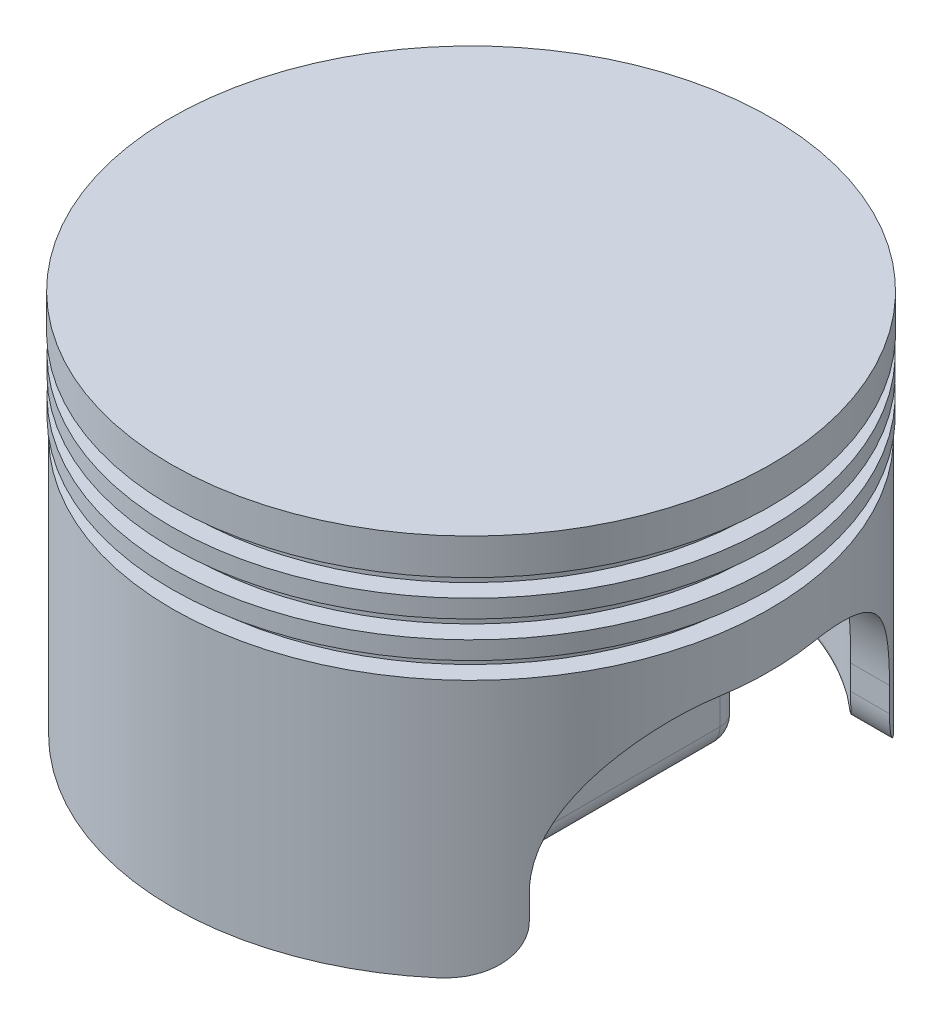
from build123d import *

# Parameters (mm, degrees)
CUT_EXTRUDE1_START  = -126.691236548
CUT_EXTRUDE1_DEPTH  = 126.382472996
BOSS_EXTRUDE5_DEPTH = 81.3
SKETCH11_R          = 13.23
CUT_EXTRUDE2_DEPTH  = 140.14202895
FILLET1_R           = 5
FILLET2_R           = 5


# Read off the part's stored shape, not the designer's step: Cut-Extrude1
with BuildPart() as part:
    # Sketch1 → Revolve1 (revolve)
    with BuildSketch(Plane.XY, mode=Mode.PRIVATE) as revolve1_sk:
        with BuildLine():
            Line((0, 0), (-63.5, 0))
            Line((-63.5, 0), (-63.5, -17.8))
            Line((-63.5, -17.8), (-8.158763552, -17.8))
            ThreePointArc((-8.158763552, -17.8), (-7.09810338, -18.239339828), (-6.658763552, -19.3))
            Line((-6.658763552, -19.3), (-6.658763552, -79.8))
            ThreePointArc((-6.658763552, -79.8), (-6.219423724, -80.860660172), (-5.158763552, -81.3))
            Line((-5.158763552, -81.3), (-0.308763552, -81.3))
            Line((-0.308763552, -81.3), (-0.308763552, -26.661382698))
            Line((-0.308763552, -26.661382698), (-4.418763552, -26.661382698))
            Line((-4.418763552, -26.661382698), (-4.418763552, -22.86))
            Line((-4.418763552, -22.86), (-0.052658916, -22.86))
            Line((-0.052658916, -22.86), (-0.052658916, -19.05))
            Line((-0.052658916, -19.05), (-4.162658916, -19.05))
            Line((-4.162658916, -19.05), (-4.162658916, -15.24))
            Line((-4.162658916, -15.24), (-0.052658916, -15.24))
            Line((-0.052658916, -15.24), (-0.052658916, -11.43))
            Line((-0.052658916, -11.43), (-4.11, -11.43))
            Line((-4.11, -11.43), (-4.11, -7.62))
            Line((-4.11, -7.62), (0, -7.62))
            Line((0, -7.62), (0, 0))
        make_face()
    revolve(revolve1_sk.sketch.rotate(Axis((-63.5, 0, 0), (0, -1, 0)), 90), axis=Axis((-63.5, 0, 0), (0, -1, 0)))

    # Cut-Extrude1 outline → Cut-Extrude1 (cut)
    with BuildSketch(Plane(origin=(0, 0, 0), x_dir=(0, 0, -1), z_dir=(1, 0, 0)).offset(CUT_EXTRUDE1_START)):
        with BuildLine():
            Line((-38.1, -66.1), (-38.1, -71.3))
            ThreePointArc((-38.1, -71.3), (-41.028932188, -78.371067812), (-48.1, -81.3))
            Line((-48.1, -81.3), (48.1, -81.3))
            ThreePointArc((48.1, -81.3), (41.028932188, -78.371067812), (38.1, -71.3))
            Line((38.1, -71.3), (38.1, -66.1))
            ThreePointArc((38.1, -66.1), (29.898989873, -46.301010127), (10.1, -38.1))
            Line((10.1, -38.1), (-10.1, -38.1))
            ThreePointArc((-10.1, -38.1), (-29.898989873, -46.301010127), (-38.1, -66.1))
        make_face()
    extrude(amount=CUT_EXTRUDE1_DEPTH, mode=Mode.SUBTRACT)

    # Sketch9 → Boss-Extrude5 (add, through all)
    with BuildSketch(Plane(origin=(0, 0, 0), x_dir=(1, 0, 0), z_dir=(0, 1, 0))):
        with BuildLine():
            Line((-91.994363562, -22.204484494), (-82.994363562, -22.204484494))
            ThreePointArc((-82.994363562, -22.204484494), (-79.458829656, -20.7400184), (-77.994363562, -17.204484494))
            Line((-77.994363562, -17.204484494), (-77.994363562, 23.595515506))
            ThreePointArc((-77.994363562, 23.595515506), (-79.458829656, 27.131049412), (-82.994363562, 28.595515506))
            Line((-82.994363562, 28.595515506), (-91.994363562, 28.595515506))
            ThreePointArc((-91.994363562, 28.595515506), (-95.529897468, 27.131049412), (-96.994363562, 23.595515506))
            Line((-96.994363562, 23.595515506), (-96.994363562, -17.204484494))
            ThreePointArc((-96.994363562, -17.204484494), (-95.529897468, -20.7400184), (-91.994363562, -22.204484494))
        make_face()
        with BuildLine():
            Line((-47.626747928, -23.024098207), (-38.626747928, -23.024098207))
            ThreePointArc((-38.626747928, -23.024098207), (-35.091214022, -21.559632113), (-33.626747928, -18.024098207))
            Line((-33.626747928, -18.024098207), (-33.626747928, 22.775901793))
            ThreePointArc((-33.626747928, 22.775901793), (-35.091214022, 26.311435699), (-38.626747928, 27.775901793))
            Line((-38.626747928, 27.775901793), (-47.626747928, 27.775901793))
            ThreePointArc((-47.626747928, 27.775901793), (-51.162281834, 26.311435699), (-52.626747928, 22.775901793))
            Line((-52.626747928, 22.775901793), (-52.626747928, -18.024098207))
            ThreePointArc((-52.626747928, -18.024098207), (-51.162281834, -21.559632113), (-47.626747928, -23.024098207))
        make_face()
    extrude(amount=-BOSS_EXTRUDE5_DEPTH)

    # Sketch11 → Cut-Extrude2 (cut, through all)
    with BuildSketch(Plane(origin=(-33.626747928, 0, 0), x_dir=(0, 0, -1), z_dir=(1, 0, 0))):
        with Locations((2.384240729, -56.3)):
            Circle(SKETCH11_R)
    extrude(amount=-CUT_EXTRUDE2_DEPTH, mode=Mode.SUBTRACT)

    # Fillet1
    fillet1_edges = [part.edges().sort_by_distance(p)[0] for p in [
        (-33.626747928, -81.3, -2.375901793),
        (-35.091214022, -81.3, 21.559632113),
        (-43.126747928, -81.3, 23.024098207),
        (-51.162281834, -81.3, 21.559632113),
        (-52.626747928, -81.3, -2.375901793),
        (-51.162281834, -81.3, -26.311435699),
        (-43.126747928, -81.3, -27.775901793),
        (-35.091214022, -81.3, -26.311435699),
    ]]
    fillet(fillet1_edges, radius=FILLET1_R)

    # Fillet2
    fillet2_edges = [part.edges().sort_by_distance(p)[0] for p in [
        (-77.994363562, -81.3, -3.195515506),
        (-79.458829656, -81.3, 20.7400184),
        (-87.494363562, -81.3, 22.204484494),
        (-95.529897468, -81.3, 20.7400184),
        (-96.994363562, -81.3, -3.195515506),
        (-95.529897468, -81.3, -27.131049412),
        (-87.494363562, -81.3, -28.595515506),
        (-79.458829656, -81.3, -27.131049412),
    ]]
    fillet(fillet2_edges, radius=FILLET2_R)


solid = part.part
